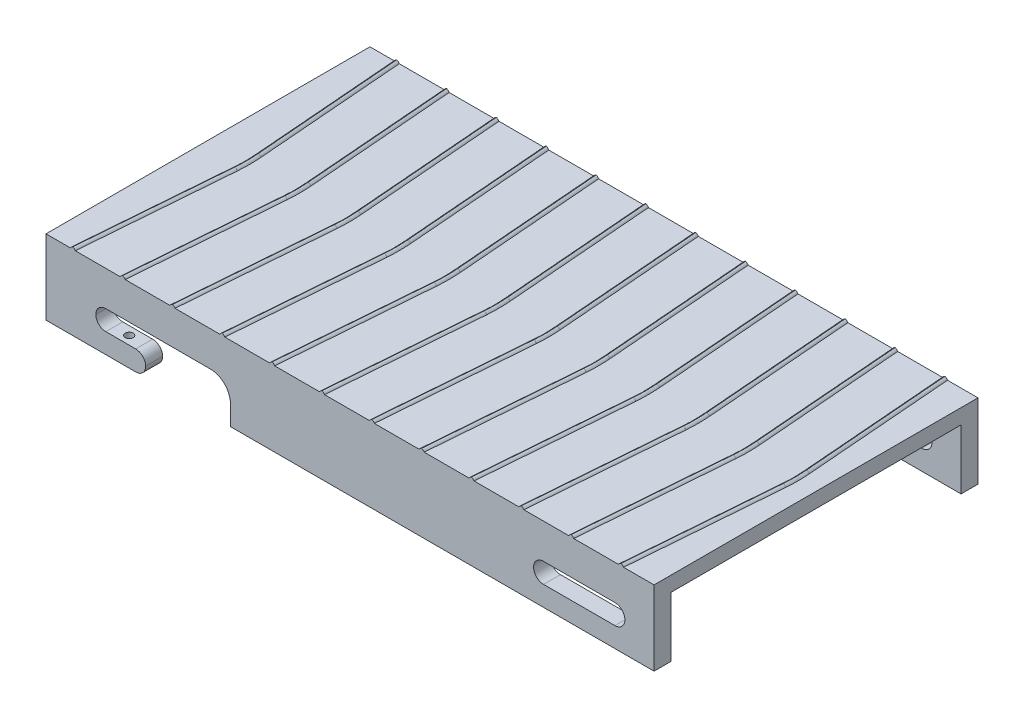
from build123d import *

# Parameters (mm, degrees)
SKETCH_1_W                     = 122
SKETCH_1_H                     = 15
EXTRUDE_1_DEPTH                = 4
CUT_EXTRUDE_1_REACH            = 124.984
CUT_EXTRUDE_2_REACH            = 124.984
SKETCH_4_W                     = 122
SKETCH_4_H                     = 3
EXTRUDE_2_DEPTH                = 32.5
FILLET_1_R                     = 2
FILLET_2_R                     = 2
FILLET_3_R                     = 4
SKETCH_5_W                     = 58.2
SKETCH_5_H                     = 12
CUT_EXTRUDE_3_DEPTH            = 138.222447143
EXTRUDE_3_DEPTH                = 0.5
FILLET_4_R                     = 30
FILLET_5_R                     = 1
PATTERN_LINEAR_1_COUNT         = 12
PATTERN_LINEAR_1_PITCH         = 10
FILLET_4_OF_PATTERN_LINEAR_1_R = 30
FILLET_5_OF_PATTERN_LINEAR_1_R = 1
HOLE_WIZARD_M2_1_D             = 1.6
HOLE_WIZARD_M2_1_DEPTH         = 4


# Some blends are built 0.0001 mm under size
with BuildPart() as part:
    # 草圖1 → 填料-伸長1 (new body)
    with BuildSketch(Plane.XY):
        with Locations((61, 7.5)):
            Rectangle(SKETCH_1_W, SKETCH_1_H)
    extrude(amount=EXTRUDE_1_DEPTH)

    # 草圖2 → 除料-伸長1 (cut, up to next)
    with BuildSketch(Plane.XY.offset(4), mode=Mode.PRIVATE) as cut_extrude_1_sk1:
        with BuildLine():
            Line((99.83, 8), (114.15, 8))
            ThreePointArc((114.15, 8), (116.15, 6), (114.15, 4))
            Line((114.15, 4), (99.83, 4))
            ThreePointArc((99.83, 4), (97.83, 6), (99.83, 8))
        make_face()
    cut_extrude_1_tool1 = extrude(cut_extrude_1_sk1.sketch, amount=-CUT_EXTRUDE_1_REACH, mode=Mode.PRIVATE) & part.part
    add(cut_extrude_1_tool1.solids().sort_by_distance((106.99, 6, 4))[0], mode=Mode.SUBTRACT)

    # 草圖3 → 除料-伸長2 (cut, up to next)
    with BuildSketch(Plane.XY.offset(4), mode=Mode.PRIVATE) as cut_extrude_2_sk1:
        Polygon((20, 0), (20, 4), (10, 4), (10, 8), (37, 8), (37, 0), align=None)
    cut_extrude_2_tool1 = extrude(cut_extrude_2_sk1.sketch, amount=-CUT_EXTRUDE_2_REACH, mode=Mode.PRIVATE) & part.part
    add(cut_extrude_2_tool1.solids().sort_by_distance((25.431818, 4.454545, 4))[0], mode=Mode.SUBTRACT)

    # 草圖4 → 填料-伸長2 (add)
    with BuildSketch(Plane.XY.offset(4)):
        with Locations((61, 13.5)):
            Rectangle(SKETCH_4_W, SKETCH_4_H)
    extrude(amount=-EXTRUDE_2_DEPTH)

    # 鏡射1: part across plane


with BuildPart() as part_1:
    add(part.part)
    add(part.part.mirror(Plane.XY.offset(-28.5)))

    # 圓角1
    fillet_1_edges = [part_1.edges().sort_by_distance(p)[0] for p in [
        (20, 0, 2),
        (20, 0, -59),
        (20, 4, -59),
        (20, 4, 2),
    ]]
    fillet(fillet_1_edges, radius=FILLET_1_R - 0.0001)  # a hair under: the kernel refuses the full size

    # 圓角2
    fillet_2_edges = [part_1.edges().sort_by_distance(p)[0] for p in [
        (10, 4, -59),
        (10, 8, -59),
        (10, 8, 2),
        (10, 4, 2),
    ]]
    fillet(fillet_2_edges, radius=FILLET_2_R - 0.0001)  # a hair under: the kernel refuses the full size

    # 圓角3
    fillet_3_edges = [part_1.edges().sort_by_distance(p)[0] for p in [
        (37, 8, 2),
        (37, 8, -59),
    ]]
    fillet(fillet_3_edges, radius=FILLET_3_R)

    # 草圖5 → 除料-伸長3 (cut, through all)
    with BuildSketch(Plane(origin=(122, 0, 0), x_dir=(0, 0, -1), z_dir=(1, 0, 0))):
        with Locations((28.5, 6)):
            Rectangle(SKETCH_5_W, SKETCH_5_H)
    extrude(amount=-CUT_EXTRUDE_3_DEPTH, mode=Mode.SUBTRACT)

    # 草圖6 → 填料-伸長3 (add)
    with BuildSketch(Plane(origin=(0, 15, 0), x_dir=(1, 0, 0), z_dir=(0, 1, 0))):
        Polygon((5.884112881, 61), (4.880951924, 61), (7.467083172, 28.5), (4.880951924, -4), (5.884112881, -4), (8.470244129, 28.5), align=None)
    extrude_3 = extrude(amount=EXTRUDE_3_DEPTH)

    # 圓角4
    fillet_4_edges = [part_1.edges().sort_by_distance(p)[0] for p in [
        (8.470244129, 15.25, -28.5),
        (7.467083172, 15.25, -28.5),
    ]]
    fillet(fillet_4_edges, radius=FILLET_4_R)

    # 圓角5
    # the kernel refuses this fillet: 1 mm, written as the material it takes off along each edge
    with BuildSketch(Plane(origin=(8.280885528, 15.5, -30.879676022), x_dir=(0, -1, 0), z_dir=(-0.0793225340604482, 0, -0.9968490034053448)), Plane(origin=(5.712374557, 15.5, 6.158241402), x_dir=(0, -1, 0), z_dir=(0.07932253406044826, 0, -0.9968490034053448))) as fillet_5_piece_1:
        with BuildLine():
            CenterArc((1, 0.866025404), FILLET_5_R, 180, 60)
            Line((0, 0.866025404), (-0.02, 0.866025404))
            Line((-0.02, 0.866025404), (-0.02, 0))
            Line((-0.02, 0), (0, -0.02))
            ThreePointArc((0, -0.02), (0.25, -0.02), (0.49, -0.017320508))
            Line((0.49, -0.017320508), (0.5, 0))
        make_face()
    extrude(amount=32.380596529, mode=Mode.SUBTRACT)
    with BuildSketch(Plane(origin=(-21.624584574, 15.5, -28.5), x_dir=(0.9968490034053447, 0, -0.07932253406044852), z_dir=(-0.07932253406044852, 0, -0.9968490034053447))) as fillet_5_piece_2:
        with BuildLine():
            CenterArc((29.133974596, 1), FILLET_5_R, 270, 60)
            Line((29.133974596, 0), (29.133974596, -0.02))
            Line((29.133974596, -0.02), (30, -0.02))
            Line((30, -0.02), (30.02, 0))
            ThreePointArc((30.02, 0), (30.02, 0.25), (30.017320508, 0.49))
            Line((30.017320508, 0.49), (30, 0.5))
        make_face()
    revolve(axis=Axis((-21.624584574, 15.5, -28.5), (0, -1, 0)), revolution_arc=9.099252091, mode=Mode.SUBTRACT)
    with BuildSketch(Plane(origin=(4.709213601, 15.5, -63.158241402), x_dir=(0.9968490034053448, 0, -0.0793225340604482), z_dir=(0.0793225340604482, 0, 0.9968490034053448)), Plane(origin=(7.277724572, 15.5, -26.120323978), x_dir=(0.9968490034053448, 0, 0.0793225340604479), z_dir=(-0.07932253406044791, 0, 0.9968490034053449))) as fillet_5_piece_3:
        with BuildLine():
            CenterArc((0.866025404, -1), FILLET_5_R, 90, 60)
            Line((0, -0.5), (-0.017320508, -0.49))
            ThreePointArc((-0.017320508, -0.49), (-0.02, -0.25), (-0.02, 0))
            Line((-0.02, 0), (0, 0.02))
            Line((0, 0.02), (0.866025404, 0.02))
            Line((0.866025404, 0.02), (0.866025404, 0))
        make_face()
    extrude(amount=32.380596529, mode=Mode.SUBTRACT)
    with BuildSketch(Plane(origin=(-22.627745531, 15.5, -28.5), x_dir=(0.9968490034053448, 0, 0.07932253406044794), z_dir=(-0.07932253406044794, 0, 0.9968490034053448))) as fillet_5_piece_4:
        with BuildLine():
            CenterArc((30.866025404, -1), FILLET_5_R, 90, 60)
            Line((30, -0.5), (29.982679492, -0.49))
            ThreePointArc((29.982679492, -0.49), (29.98, -0.25), (29.98, 0))
            Line((29.98, 0), (30, 0.02))
            Line((30, 0.02), (30.866025404, 0.02))
            Line((30.866025404, 0.02), (30.866025404, 0))
        make_face()
    revolve(axis=Axis((-22.627745531, 15.5, -28.5), (0, 1, 0)), revolution_arc=9.099252091, mode=Mode.SUBTRACT)

    # 直線複製排列1: 填料-伸長3 ×12
    with Locations(*[(i * PATTERN_LINEAR_1_PITCH, 0, 0) for i in range(1, PATTERN_LINEAR_1_COUNT)]):
        add(extrude_3)

    # 圓角4 of 直線複製排列1
    fillet_4_of_pattern_linear_1_edges = [part_1.edges().sort_by_distance(p)[0] for p in [
        (18.470244129, 15.25, -28.5),
        (17.467083172, 15.25, -28.5),
        (28.470244129, 15.25, -28.5),
        (27.467083172, 15.25, -28.5),
        (38.470244129, 15.25, -28.5),
        (37.467083172, 15.25, -28.5),
        (48.470244129, 15.25, -28.5),
        (47.467083172, 15.25, -28.5),
        (58.470244129, 15.25, -28.5),
        (57.467083172, 15.25, -28.5),
        (68.470244129, 15.25, -28.5),
        (67.467083172, 15.25, -28.5),
        (78.470244129, 15.25, -28.5),
        (77.467083172, 15.25, -28.5),
        (88.470244129, 15.25, -28.5),
        (87.467083172, 15.25, -28.5),
        (98.470244129, 15.25, -28.5),
        (97.467083172, 15.25, -28.5),
        (108.470244129, 15.25, -28.5),
        (107.467083172, 15.25, -28.5),
        (118.470244129, 15.25, -28.5),
        (117.467083172, 15.25, -28.5),
    ]]
    fillet(fillet_4_of_pattern_linear_1_edges, radius=FILLET_4_OF_PATTERN_LINEAR_1_R)

    # 圓角5 of 直線複製排列1
    # the kernel refuses this fillet: 1 mm, written as the material it takes off along each edge
    with BuildSketch(Plane(origin=(18.280885528, 15.5, -30.879676022), x_dir=(-0.9968490034053448, 0, 0.0793225340604482), z_dir=(-0.0793225340604482, 0, -0.9968490034053448)), Plane(origin=(15.712374557, 15.5, 6.158241402), x_dir=(-0.9968490034053448, 0, -0.07932253406044826), z_dir=(0.07932253406044826, 0, -0.9968490034053448)), Plane(origin=(28.280885528, 15.5, -30.879676022), x_dir=(-0.9968490034053448, 0, 0.07932253406044819), z_dir=(-0.0793225340604482, 0, -0.9968490034053448)), Plane(origin=(24.709213601, 15.5, -63.158241402), x_dir=(0.9968490034053448, 0, -0.0793225340604482), z_dir=(0.0793225340604482, 0, 0.9968490034053448)), Plane(origin=(27.277724572, 15.5, -26.120323978), x_dir=(0.9968490034053447, 0, 0.0793225340604479), z_dir=(-0.07932253406044791, 0, 0.9968490034053449)), Plane(origin=(38.280885528, 15.5, -30.879676022), x_dir=(-0.9968490034053449, 0, 0.07932253406044822), z_dir=(-0.0793225340604482, 0, -0.9968490034053448)), Plane(origin=(34.709213601, 15.5, -63.158241402), x_dir=(0.9968490034053448, 0, -0.07932253406044822), z_dir=(0.0793225340604482, 0, 0.9968490034053448)), Plane(origin=(37.277724572, 15.5, -26.120323978), x_dir=(0.9968490034053449, 0, 0.0793225340604479), z_dir=(-0.07932253406044791, 0, 0.9968490034053449)), Plane(origin=(48.280885528, 15.5, -30.879676022), x_dir=(-0.9968490034053448, 0, 0.0793225340604482), z_dir=(-0.0793225340604482, 0, -0.9968490034053448)), Plane(origin=(44.709213601, 15.5, -63.158241402), x_dir=(0.9968490034053447, 0, -0.07932253406044819), z_dir=(0.0793225340604482, 0, 0.9968490034053448)), Plane(origin=(47.277724572, 15.5, -26.120323978), x_dir=(0.9968490034053449, 0, 0.0793225340604479), z_dir=(-0.07932253406044791, 0, 0.9968490034053449)), Plane(origin=(58.280885528, 15.5, -30.879676022), x_dir=(-0.9968490034053448, 0, 0.07932253406044819), z_dir=(-0.0793225340604482, 0, -0.9968490034053448)), Plane(origin=(54.709213601, 15.5, -63.158241402), x_dir=(0.9968490034053448, 0, -0.07932253406044822), z_dir=(0.0793225340604482, 0, 0.9968490034053448)), Plane(origin=(57.277724572, 15.5, -26.120323978), x_dir=(0.9968490034053449, 0, 0.0793225340604479), z_dir=(-0.07932253406044791, 0, 0.9968490034053449)), Plane(origin=(68.280885528, 15.5, -30.879676022), x_dir=(-0.9968490034053449, 0, 0.07932253406044822), z_dir=(-0.0793225340604482, 0, -0.9968490034053448)), Plane(origin=(64.709213601, 15.5, -63.158241402), x_dir=(0.9968490034053448, 0, -0.0793225340604482), z_dir=(0.0793225340604482, 0, 0.9968490034053448)), Plane(origin=(67.277724572, 15.5, -26.120323978), x_dir=(0.9968490034053449, 0, 0.07932253406044791), z_dir=(-0.07932253406044791, 0, 0.9968490034053449)), Plane(origin=(78.280885528, 15.5, -30.879676022), x_dir=(-0.9968490034053449, 0, 0.07932253406044822), z_dir=(-0.0793225340604482, 0, -0.9968490034053448)), Plane(origin=(74.709213601, 15.5, -63.158241402), x_dir=(0.9968490034053448, 0, -0.0793225340604482), z_dir=(0.0793225340604482, 0, 0.9968490034053448)), Plane(origin=(77.277724572, 15.5, -26.120323978), x_dir=(0.9968490034053449, 0, 0.07932253406044791), z_dir=(-0.07932253406044791, 0, 0.9968490034053449)), Plane(origin=(88.280885528, 15.5, -30.879676022), x_dir=(-0.9968490034053449, 0, 0.07932253406044822), z_dir=(-0.0793225340604482, 0, -0.9968490034053448)), Plane(origin=(84.709213601, 15.5, -63.158241402), x_dir=(0.9968490034053448, 0, -0.0793225340604482), z_dir=(0.0793225340604482, 0, 0.9968490034053448)), Plane(origin=(87.277724572, 15.5, -26.120323978), x_dir=(0.9968490034053449, 0, 0.07932253406044791), z_dir=(-0.07932253406044791, 0, 0.9968490034053449)), Plane(origin=(98.280885528, 15.5, -30.879676022), x_dir=(-0.9968490034053449, 0, 0.07932253406044822), z_dir=(-0.0793225340604482, 0, -0.9968490034053448)), Plane(origin=(94.709213601, 15.5, -63.158241402), x_dir=(0.9968490034053448, 0, -0.0793225340604482), z_dir=(0.0793225340604482, 0, 0.9968490034053448)), Plane(origin=(97.277724572, 15.5, -26.120323978), x_dir=(0.9968490034053449, 0, 0.07932253406044791), z_dir=(-0.07932253406044791, 0, 0.9968490034053449)), Plane(origin=(108.280885528, 15.5, -30.879676022), x_dir=(-0.9968490034053449, 0, 0.07932253406044822), z_dir=(-0.0793225340604482, 0, -0.9968490034053448)), Plane(origin=(104.709213601, 15.5, -63.158241402), x_dir=(0.9968490034053448, 0, -0.0793225340604482), z_dir=(0.0793225340604482, 0, 0.9968490034053448)), Plane(origin=(107.277724572, 15.5, -26.120323978), x_dir=(0.9968490034053449, 0, 0.07932253406044791), z_dir=(-0.07932253406044791, 0, 0.9968490034053449)), Plane(origin=(118.280885528, 15.5, -30.879676022), x_dir=(-0.9968490034053449, 0, 0.07932253406044822), z_dir=(-0.0793225340604482, 0, -0.9968490034053448)), Plane(origin=(114.709213601, 15.5, -63.158241402), x_dir=(0.9968490034053448, 0, -0.0793225340604482), z_dir=(0.0793225340604482, 0, 0.9968490034053448)), Plane(origin=(117.277724572, 15.5, -26.120323978), x_dir=(0.9968490034053449, 0, 0.07932253406044791), z_dir=(-0.07932253406044791, 0, 0.9968490034053449))) as fillet_5_of_pattern_linear_1_piece_1:
        with BuildLine():
            CenterArc((0.866025404, -1), FILLET_5_OF_PATTERN_LINEAR_1_R, 90, 60)
            Line((0, -0.5), (-0.017320508, -0.49))
            ThreePointArc((-0.017320508, -0.49), (-0.02, -0.25), (-0.02, 0))
            Line((-0.02, 0), (0, 0.02))
            Line((0, 0.02), (0.866025404, 0.02))
            Line((0.866025404, 0.02), (0.866025404, 0))
        make_face()
    extrude(amount=32.380596529, mode=Mode.SUBTRACT)
    with BuildSketch(Plane(origin=(-11.624584574, 15.5, -28.5), x_dir=(0.9968490034053447, 0, 0.0793225340604484), z_dir=(-0.0793225340604484, 0, 0.9968490034053447))) as fillet_5_of_pattern_linear_1_piece_2:
        with BuildLine():
            CenterArc((29.133974596, -1), FILLET_5_OF_PATTERN_LINEAR_1_R, 30, 60)
            Line((30, -0.5), (30.017320508, -0.49))
            ThreePointArc((30.017320508, -0.49), (30.02, -0.25), (30.02, 0))
            Line((30.02, 0), (30, 0.02))
            Line((30, 0.02), (29.133974596, 0.02))
            Line((29.133974596, 0.02), (29.133974596, 0))
        make_face()
    revolve(axis=Axis((-11.624584574, 15.5, -28.5), (0, 1, 0)), revolution_arc=9.099252091, mode=Mode.SUBTRACT)
    with BuildSketch(Plane(origin=(14.709213601, 15.5, -63.158241402), x_dir=(0, -1, 0), z_dir=(0.0793225340604482, 0, 0.9968490034053448)), Plane(origin=(17.277724572, 15.5, -26.120323978), x_dir=(0, -1, 0), z_dir=(-0.07932253406044791, 0, 0.9968490034053449)), Plane(origin=(25.712374557, 15.5, 6.158241402), x_dir=(0, -1, 0), z_dir=(0.07932253406044826, 0, -0.9968490034053448)), Plane(origin=(35.712374557, 15.5, 6.158241402), x_dir=(0, -1, 0), z_dir=(0.07932253406044826, 0, -0.9968490034053448)), Plane(origin=(45.712374557, 15.5, 6.158241402), x_dir=(0, -1, 0), z_dir=(0.07932253406044826, 0, -0.9968490034053448)), Plane(origin=(55.712374557, 15.5, 6.158241402), x_dir=(0, -1, 0), z_dir=(0.07932253406044826, 0, -0.9968490034053448)), Plane(origin=(65.712374557, 15.5, 6.158241402), x_dir=(0, -1, 0), z_dir=(0.07932253406044826, 0, -0.9968490034053448)), Plane(origin=(75.712374557, 15.5, 6.158241402), x_dir=(0, -1, 0), z_dir=(0.07932253406044826, 0, -0.9968490034053448)), Plane(origin=(85.712374557, 15.5, 6.158241402), x_dir=(0, -1, 0), z_dir=(0.07932253406044826, 0, -0.9968490034053448)), Plane(origin=(95.712374557, 15.5, 6.158241402), x_dir=(0, -1, 0), z_dir=(0.07932253406044826, 0, -0.9968490034053448)), Plane(origin=(105.712374557, 15.5, 6.158241402), x_dir=(0, -1, 0), z_dir=(0.07932253406044826, 0, -0.9968490034053448)), Plane(origin=(115.712374557, 15.5, 6.158241402), x_dir=(0, -1, 0), z_dir=(0.07932253406044826, 0, -0.9968490034053448))) as fillet_5_of_pattern_linear_1_piece_3:
        with BuildLine():
            CenterArc((1, 0.866025404), FILLET_5_OF_PATTERN_LINEAR_1_R, 180, 60)
            Line((0, 0.866025404), (-0.02, 0.866025404))
            Line((-0.02, 0.866025404), (-0.02, 0))
            Line((-0.02, 0), (0, -0.02))
            ThreePointArc((0, -0.02), (0.25, -0.02), (0.49, -0.017320508))
            Line((0.49, -0.017320508), (0.5, 0))
        make_face()
    extrude(amount=32.380596529, mode=Mode.SUBTRACT)
    with BuildSketch(Plane(origin=(-12.627745531, 15.5, -28.5), x_dir=(0.9968490034053448, 0, 0.07932253406044794), z_dir=(-0.07932253406044794, 0, 0.9968490034053448))) as fillet_5_of_pattern_linear_1_piece_4:
        with BuildLine():
            CenterArc((30.866025404, -1), FILLET_5_OF_PATTERN_LINEAR_1_R, 90, 60)
            Line((30.866025404, 0), (30.866025404, 0.02))
            Line((30.866025404, 0.02), (30, 0.02))
            Line((30, 0.02), (29.98, 0))
            ThreePointArc((29.98, 0), (29.98, -0.25), (29.982679492, -0.49))
            Line((29.982679492, -0.49), (30, -0.5))
        make_face()
    revolve(axis=Axis((-12.627745531, 15.5, -28.5), (0, 1, 0)), revolution_arc=9.099252091, mode=Mode.SUBTRACT)
    with BuildSketch(Plane(origin=(-1.624584574, 15.5, -28.5), x_dir=(0.9968490034053447, 0, 0.0793225340604484), z_dir=(-0.0793225340604484, 0, 0.9968490034053447))) as fillet_5_of_pattern_linear_1_piece_5:
        with BuildLine():
            CenterArc((29.133974596, -1), FILLET_5_OF_PATTERN_LINEAR_1_R, 30, 60)
            Line((30, -0.5), (30.017320508, -0.49))
            ThreePointArc((30.017320508, -0.49), (30.02, -0.25), (30.02, 0))
            Line((30.02, 0), (30, 0.02))
            Line((30, 0.02), (29.133974596, 0.02))
            Line((29.133974596, 0.02), (29.133974596, 0))
        make_face()
    revolve(axis=Axis((-1.624584574, 15.5, -28.5), (0, 1, 0)), revolution_arc=9.099252091, mode=Mode.SUBTRACT)
    with BuildSketch(Plane(origin=(-2.627745531, 15.5, -28.5), x_dir=(0.9968490034053448, 0, 0.07932253406044794), z_dir=(-0.07932253406044794, 0, 0.9968490034053448))) as fillet_5_of_pattern_linear_1_piece_6:
        with BuildLine():
            CenterArc((30.866025404, -1), FILLET_5_OF_PATTERN_LINEAR_1_R, 90, 60)
            Line((30, -0.5), (29.982679492, -0.49))
            ThreePointArc((29.982679492, -0.49), (29.98, -0.25), (29.98, 0))
            Line((29.98, 0), (30, 0.02))
            Line((30, 0.02), (30.866025404, 0.02))
            Line((30.866025404, 0.02), (30.866025404, 0))
        make_face()
    revolve(axis=Axis((-2.627745531, 15.5, -28.5), (0, 1, 0)), revolution_arc=9.099252091, mode=Mode.SUBTRACT)
    with BuildSketch(Plane(origin=(8.375415426, 15.5, -28.5), x_dir=(0.9968490034053448, 0, 0.0793225340604483), z_dir=(-0.0793225340604483, 0, 0.9968490034053448))) as fillet_5_of_pattern_linear_1_piece_7:
        with BuildLine():
            CenterArc((29.133974596, -1), FILLET_5_OF_PATTERN_LINEAR_1_R, 30, 60)
            Line((30, -0.5), (30.017320508, -0.49))
            ThreePointArc((30.017320508, -0.49), (30.02, -0.25), (30.02, 0))
            Line((30.02, 0), (30, 0.02))
            Line((30, 0.02), (29.133974596, 0.02))
            Line((29.133974596, 0.02), (29.133974596, 0))
        make_face()
    revolve(axis=Axis((8.375415426, 15.5, -28.5), (0, 1, 0)), revolution_arc=9.099252091, mode=Mode.SUBTRACT)
    with BuildSketch(Plane(origin=(7.372254469, 15.5, -28.5), x_dir=(0.9968490034053448, 0, 0.07932253406044792), z_dir=(-0.07932253406044792, 0, 0.9968490034053448))) as fillet_5_of_pattern_linear_1_piece_8:
        with BuildLine():
            CenterArc((30.866025404, -1), FILLET_5_OF_PATTERN_LINEAR_1_R, 90, 60)
            Line((30, -0.5), (29.982679492, -0.49))
            ThreePointArc((29.982679492, -0.49), (29.98, -0.25), (29.98, 0))
            Line((29.98, 0), (30, 0.02))
            Line((30, 0.02), (30.866025404, 0.02))
            Line((30.866025404, 0.02), (30.866025404, 0))
        make_face()
    revolve(axis=Axis((7.372254469, 15.5, -28.5), (0, 1, 0)), revolution_arc=9.099252091, mode=Mode.SUBTRACT)
    with BuildSketch(Plane(origin=(18.375415426, 15.5, -28.5), x_dir=(0.9968490034053448, 0, 0.0793225340604483), z_dir=(-0.0793225340604483, 0, 0.9968490034053448))) as fillet_5_of_pattern_linear_1_piece_9:
        with BuildLine():
            CenterArc((29.133974596, -1), FILLET_5_OF_PATTERN_LINEAR_1_R, 30, 60)
            Line((30, -0.5), (30.017320508, -0.49))
            ThreePointArc((30.017320508, -0.49), (30.02, -0.25), (30.02, 0))
            Line((30.02, 0), (30, 0.02))
            Line((30, 0.02), (29.133974596, 0.02))
            Line((29.133974596, 0.02), (29.133974596, 0))
        make_face()
    revolve(axis=Axis((18.375415426, 15.5, -28.5), (0, 1, 0)), revolution_arc=9.099252091, mode=Mode.SUBTRACT)
    with BuildSketch(Plane(origin=(17.372254469, 15.5, -28.5), x_dir=(0.9968490034053448, 0, 0.07932253406044792), z_dir=(-0.07932253406044792, 0, 0.9968490034053448))) as fillet_5_of_pattern_linear_1_piece_10:
        with BuildLine():
            CenterArc((30.866025404, -1), FILLET_5_OF_PATTERN_LINEAR_1_R, 90, 60)
            Line((30, -0.5), (29.982679492, -0.49))
            ThreePointArc((29.982679492, -0.49), (29.98, -0.25), (29.98, 0))
            Line((29.98, 0), (30, 0.02))
            Line((30, 0.02), (30.866025404, 0.02))
            Line((30.866025404, 0.02), (30.866025404, 0))
        make_face()
    revolve(axis=Axis((17.372254469, 15.5, -28.5), (0, 1, 0)), revolution_arc=9.099252091, mode=Mode.SUBTRACT)
    with BuildSketch(Plane(origin=(28.375415426, 15.5, -28.5), x_dir=(0.9968490034053448, 0, 0.07932253406044842), z_dir=(-0.07932253406044842, 0, 0.9968490034053448))) as fillet_5_of_pattern_linear_1_piece_11:
        with BuildLine():
            CenterArc((29.133974596, -1), FILLET_5_OF_PATTERN_LINEAR_1_R, 30, 60)
            Line((30, -0.5), (30.017320508, -0.49))
            ThreePointArc((30.017320508, -0.49), (30.02, -0.25), (30.02, 0))
            Line((30.02, 0), (30, 0.02))
            Line((30, 0.02), (29.133974596, 0.02))
            Line((29.133974596, 0.02), (29.133974596, 0))
        make_face()
    revolve(axis=Axis((28.375415426, 15.5, -28.5), (0, 1, 0)), revolution_arc=9.099252091, mode=Mode.SUBTRACT)
    with BuildSketch(Plane(origin=(27.372254469, 15.5, -28.5), x_dir=(0.9968490034053448, 0, 0.07932253406044792), z_dir=(-0.07932253406044792, 0, 0.9968490034053448))) as fillet_5_of_pattern_linear_1_piece_12:
        with BuildLine():
            CenterArc((30.866025404, -1), FILLET_5_OF_PATTERN_LINEAR_1_R, 90, 60)
            Line((30, -0.5), (29.982679492, -0.49))
            ThreePointArc((29.982679492, -0.49), (29.98, -0.25), (29.98, 0))
            Line((29.98, 0), (30, 0.02))
            Line((30, 0.02), (30.866025404, 0.02))
            Line((30.866025404, 0.02), (30.866025404, 0))
        make_face()
    revolve(axis=Axis((27.372254469, 15.5, -28.5), (0, 1, 0)), revolution_arc=9.099252091, mode=Mode.SUBTRACT)
    with BuildSketch(Plane(origin=(38.375415426, 15.5, -28.5), x_dir=(0.9968490034053447, 0, 0.07932253406044838), z_dir=(-0.07932253406044838, 0, 0.9968490034053447))) as fillet_5_of_pattern_linear_1_piece_13:
        with BuildLine():
            CenterArc((29.133974596, -1), FILLET_5_OF_PATTERN_LINEAR_1_R, 30, 60)
            Line((30, -0.5), (30.017320508, -0.49))
            ThreePointArc((30.017320508, -0.49), (30.02, -0.25), (30.02, 0))
            Line((30.02, 0), (30, 0.02))
            Line((30, 0.02), (29.133974596, 0.02))
            Line((29.133974596, 0.02), (29.133974596, 0))
        make_face()
    revolve(axis=Axis((38.375415426, 15.5, -28.5), (0, 1, 0)), revolution_arc=9.099252091, mode=Mode.SUBTRACT)
    with BuildSketch(Plane(origin=(37.372254469, 15.5, -28.5), x_dir=(0.9968490034053448, 0, 0.07932253406044791), z_dir=(-0.07932253406044791, 0, 0.9968490034053448))) as fillet_5_of_pattern_linear_1_piece_14:
        with BuildLine():
            CenterArc((30.866025404, -1), FILLET_5_OF_PATTERN_LINEAR_1_R, 90, 60)
            Line((30, -0.5), (29.982679492, -0.49))
            ThreePointArc((29.982679492, -0.49), (29.98, -0.25), (29.98, 0))
            Line((29.98, 0), (30, 0.02))
            Line((30, 0.02), (30.866025404, 0.02))
            Line((30.866025404, 0.02), (30.866025404, 0))
        make_face()
    revolve(axis=Axis((37.372254469, 15.5, -28.5), (0, 1, 0)), revolution_arc=9.099252091, mode=Mode.SUBTRACT)
    with BuildSketch(Plane(origin=(48.375415426, 15.5, -28.5), x_dir=(0.9968490034053447, 0, 0.07932253406044838), z_dir=(-0.07932253406044838, 0, 0.9968490034053447))) as fillet_5_of_pattern_linear_1_piece_15:
        with BuildLine():
            CenterArc((29.133974596, -1), FILLET_5_OF_PATTERN_LINEAR_1_R, 30, 60)
            Line((30, -0.5), (30.017320508, -0.49))
            ThreePointArc((30.017320508, -0.49), (30.02, -0.25), (30.02, 0))
            Line((30.02, 0), (30, 0.02))
            Line((30, 0.02), (29.133974596, 0.02))
            Line((29.133974596, 0.02), (29.133974596, 0))
        make_face()
    revolve(axis=Axis((48.375415426, 15.5, -28.5), (0, 1, 0)), revolution_arc=9.099252091, mode=Mode.SUBTRACT)
    with BuildSketch(Plane(origin=(47.372254469, 15.5, -28.5), x_dir=(0.9968490034053448, 0, 0.07932253406044791), z_dir=(-0.07932253406044791, 0, 0.9968490034053448))) as fillet_5_of_pattern_linear_1_piece_16:
        with BuildLine():
            CenterArc((30.866025404, -1), FILLET_5_OF_PATTERN_LINEAR_1_R, 90, 60)
            Line((30, -0.5), (29.982679492, -0.49))
            ThreePointArc((29.982679492, -0.49), (29.98, -0.25), (29.98, 0))
            Line((29.98, 0), (30, 0.02))
            Line((30, 0.02), (30.866025404, 0.02))
            Line((30.866025404, 0.02), (30.866025404, 0))
        make_face()
    revolve(axis=Axis((47.372254469, 15.5, -28.5), (0, 1, 0)), revolution_arc=9.099252091, mode=Mode.SUBTRACT)
    with BuildSketch(Plane(origin=(58.375415426, 15.5, -28.5), x_dir=(0.9968490034053447, 0, 0.07932253406044838), z_dir=(-0.07932253406044838, 0, 0.9968490034053447))) as fillet_5_of_pattern_linear_1_piece_17:
        with BuildLine():
            CenterArc((29.133974596, -1), FILLET_5_OF_PATTERN_LINEAR_1_R, 30, 60)
            Line((30, -0.5), (30.017320508, -0.49))
            ThreePointArc((30.017320508, -0.49), (30.02, -0.25), (30.02, 0))
            Line((30.02, 0), (30, 0.02))
            Line((30, 0.02), (29.133974596, 0.02))
            Line((29.133974596, 0.02), (29.133974596, 0))
        make_face()
    revolve(axis=Axis((58.375415426, 15.5, -28.5), (0, 1, 0)), revolution_arc=9.099252091, mode=Mode.SUBTRACT)
    with BuildSketch(Plane(origin=(57.372254469, 15.5, -28.5), x_dir=(0.9968490034053448, 0, 0.07932253406044791), z_dir=(-0.07932253406044791, 0, 0.9968490034053448))) as fillet_5_of_pattern_linear_1_piece_18:
        with BuildLine():
            CenterArc((30.866025404, -1), FILLET_5_OF_PATTERN_LINEAR_1_R, 90, 60)
            Line((30, -0.5), (29.982679492, -0.49))
            ThreePointArc((29.982679492, -0.49), (29.98, -0.25), (29.98, 0))
            Line((29.98, 0), (30, 0.02))
            Line((30, 0.02), (30.866025404, 0.02))
            Line((30.866025404, 0.02), (30.866025404, 0))
        make_face()
    revolve(axis=Axis((57.372254469, 15.5, -28.5), (0, 1, 0)), revolution_arc=9.099252091, mode=Mode.SUBTRACT)
    with BuildSketch(Plane(origin=(68.375415426, 15.5, -28.5), x_dir=(0.9968490034053447, 0, 0.07932253406044838), z_dir=(-0.07932253406044838, 0, 0.9968490034053447))) as fillet_5_of_pattern_linear_1_piece_19:
        with BuildLine():
            CenterArc((29.133974596, -1), FILLET_5_OF_PATTERN_LINEAR_1_R, 30, 60)
            Line((30, -0.5), (30.017320508, -0.49))
            ThreePointArc((30.017320508, -0.49), (30.02, -0.25), (30.02, 0))
            Line((30.02, 0), (30, 0.02))
            Line((30, 0.02), (29.133974596, 0.02))
            Line((29.133974596, 0.02), (29.133974596, 0))
        make_face()
    revolve(axis=Axis((68.375415426, 15.5, -28.5), (0, 1, 0)), revolution_arc=9.099252091, mode=Mode.SUBTRACT)
    with BuildSketch(Plane(origin=(67.372254469, 15.5, -28.5), x_dir=(0.9968490034053448, 0, 0.07932253406044791), z_dir=(-0.07932253406044791, 0, 0.9968490034053448))) as fillet_5_of_pattern_linear_1_piece_20:
        with BuildLine():
            CenterArc((30.866025404, -1), FILLET_5_OF_PATTERN_LINEAR_1_R, 90, 60)
            Line((30, -0.5), (29.982679492, -0.49))
            ThreePointArc((29.982679492, -0.49), (29.98, -0.25), (29.98, 0))
            Line((29.98, 0), (30, 0.02))
            Line((30, 0.02), (30.866025404, 0.02))
            Line((30.866025404, 0.02), (30.866025404, 0))
        make_face()
    revolve(axis=Axis((67.372254469, 15.5, -28.5), (0, 1, 0)), revolution_arc=9.099252091, mode=Mode.SUBTRACT)
    with BuildSketch(Plane(origin=(78.375415426, 15.5, -28.5), x_dir=(0.9968490034053447, 0, 0.07932253406044838), z_dir=(-0.07932253406044838, 0, 0.9968490034053447))) as fillet_5_of_pattern_linear_1_piece_21:
        with BuildLine():
            CenterArc((29.133974596, -1), FILLET_5_OF_PATTERN_LINEAR_1_R, 30, 60)
            Line((30, -0.5), (30.017320508, -0.49))
            ThreePointArc((30.017320508, -0.49), (30.02, -0.25), (30.02, 0))
            Line((30.02, 0), (30, 0.02))
            Line((30, 0.02), (29.133974596, 0.02))
            Line((29.133974596, 0.02), (29.133974596, 0))
        make_face()
    revolve(axis=Axis((78.375415426, 15.5, -28.5), (0, 1, 0)), revolution_arc=9.099252091, mode=Mode.SUBTRACT)
    with BuildSketch(Plane(origin=(77.372254469, 15.5, -28.5), x_dir=(0.9968490034053448, 0, 0.07932253406044791), z_dir=(-0.07932253406044791, 0, 0.9968490034053448))) as fillet_5_of_pattern_linear_1_piece_22:
        with BuildLine():
            CenterArc((30.866025404, -1), FILLET_5_OF_PATTERN_LINEAR_1_R, 90, 60)
            Line((30, -0.5), (29.982679492, -0.49))
            ThreePointArc((29.982679492, -0.49), (29.98, -0.25), (29.98, 0))
            Line((29.98, 0), (30, 0.02))
            Line((30, 0.02), (30.866025404, 0.02))
            Line((30.866025404, 0.02), (30.866025404, 0))
        make_face()
    revolve(axis=Axis((77.372254469, 15.5, -28.5), (0, 1, 0)), revolution_arc=9.099252091, mode=Mode.SUBTRACT)
    with BuildSketch(Plane(origin=(88.375415426, 15.5, -28.5), x_dir=(0.9968490034053447, 0, -0.0793225340604485), z_dir=(-0.0793225340604485, 0, -0.9968490034053447))) as fillet_5_of_pattern_linear_1_piece_23:
        with BuildLine():
            CenterArc((29.133974596, 1), FILLET_5_OF_PATTERN_LINEAR_1_R, 270, 60)
            Line((30, 0.5), (30.017320508, 0.49))
            ThreePointArc((30.017320508, 0.49), (30.02, 0.25), (30.02, 0))
            Line((30.02, 0), (30, -0.02))
            Line((30, -0.02), (29.133974596, -0.02))
            Line((29.133974596, -0.02), (29.133974596, 0))
        make_face()
    revolve(axis=Axis((88.375415426, 15.5, -28.5), (0, -1, 0)), revolution_arc=9.099252091, mode=Mode.SUBTRACT)
    with BuildSketch(Plane(origin=(87.372254469, 15.5, -28.5), x_dir=(0.9968490034053448, 0, 0.07932253406044791), z_dir=(-0.07932253406044791, 0, 0.9968490034053448))) as fillet_5_of_pattern_linear_1_piece_24:
        with BuildLine():
            CenterArc((30.866025404, -1), FILLET_5_OF_PATTERN_LINEAR_1_R, 90, 60)
            Line((30, -0.5), (29.982679492, -0.49))
            ThreePointArc((29.982679492, -0.49), (29.98, -0.25), (29.98, 0))
            Line((29.98, 0), (30, 0.02))
            Line((30, 0.02), (30.866025404, 0.02))
            Line((30.866025404, 0.02), (30.866025404, 0))
        make_face()
    revolve(axis=Axis((87.372254469, 15.5, -28.5), (0, 1, 0)), revolution_arc=9.099252091, mode=Mode.SUBTRACT)

    # M2 螺紋孔1
    with Locations(Plane(origin=(0, 0, 0), x_dir=(-1, 0, 0), z_dir=(0, -1, 0))):
        with Locations((-15, -2.3), (-15, 59.3)):
            Hole(HOLE_WIZARD_M2_1_D / 2, depth=HOLE_WIZARD_M2_1_DEPTH)


solid = part_1.part
